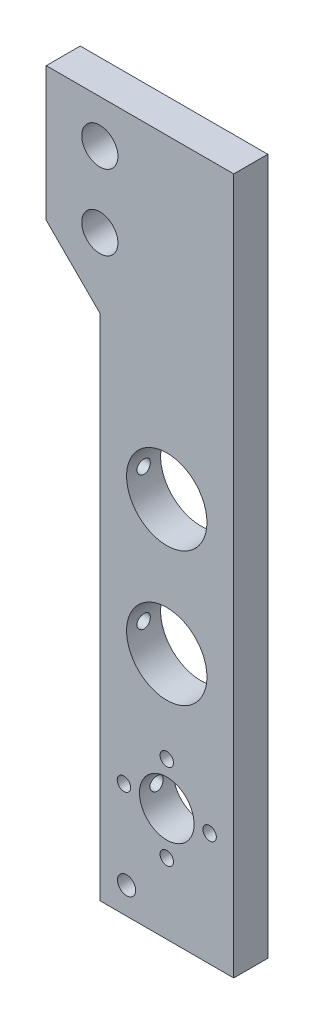
from build123d import *

# Parameters (mm, degrees)
SKETCH2_W                       = 25
SKETCH2_H                       = 130
SKETCH2_R                       = 5.1
SKETCH2_R_2                     = 7.5
BOSS_EXTRUDE1_DEPTH             = 6.35
TAP_DRILL_FOR_M3X0_5_TAP1_D     = 2.5
TAP_DRILL_FOR_M3X0_5_TAP1_DEPTH = 12.5
TAP_DRILL_FOR_M3X0_5_TAP1_TIP   = 0.751075774
BOSS_EXTRUDE2_DEPTH             = 6.35
F_1_4_CLEARANCE_HOLE1_D         = 6.7564
TAP_DRILL_FOR_M3X0_5_TAP2_D     = 2.5
M3_CLEARANCE_HOLE1_OUTLINE_R    = 1.7
M3_CLEARANCE_HOLE1_DEPTH        = 6.35


# Read off the part's stored shape, not the designer's step: M3 Clearance Hole1
with BuildPart() as part:
    # Sketch2 → Boss-Extrude1 (new body)
    with BuildSketch(Plane.XY):
        with Locations((0, 43.85)):
            Rectangle(SKETCH2_W, SKETCH2_H)
        Circle(SKETCH2_R, mode=Mode.SUBTRACT)
        with Locations((0, 25)):
            Circle(SKETCH2_R_2, mode=Mode.SUBTRACT)
        with Locations((0, 50)):
            Circle(SKETCH2_R_2, mode=Mode.SUBTRACT)
    extrude(amount=BOSS_EXTRUDE1_DEPTH)

    # Tap Drill for M3x0.5 Tap1
    with Locations(Plane.ZY.offset(12.5)):
        with Locations((3.175, 50), (3.175, 0), (3.175, 25)):
            Hole(TAP_DRILL_FOR_M3X0_5_TAP1_D / 2, depth=TAP_DRILL_FOR_M3X0_5_TAP1_DEPTH)
            with Locations((0, 0, -(TAP_DRILL_FOR_M3X0_5_TAP1_DEPTH + TAP_DRILL_FOR_M3X0_5_TAP1_TIP / 2))):  # 118° drill point
                Cone(0, TAP_DRILL_FOR_M3X0_5_TAP1_D / 2, TAP_DRILL_FOR_M3X0_5_TAP1_TIP, mode=Mode.SUBTRACT)

    # Sketch8 → Boss-Extrude2 (add)
    with BuildSketch(Plane(origin=(0, 0, 0), x_dir=(-1, 0, 0), z_dir=(0, 0, -1))):
        Polygon((12.5, 73.85), (22.5, 83.85), (22.5, 108.85), (12.5, 108.85), align=None)
    extrude(amount=-BOSS_EXTRUDE2_DEPTH)

    # 1/4 Clearance Hole1 (through all)
    with Locations(Plane.XY.offset(6.35)):
        with Locations((-12.5, 86.85), (-12.5, 100.85)):
            Hole(F_1_4_CLEARANCE_HOLE1_D / 2)

    # Tap Drill for M3x0.5 Tap2 (through all)
    with Locations(Plane.XY.offset(6.35)):
        with Locations((-8, 0), (0, 8), (8, 0), (0, -8)):
            Hole(TAP_DRILL_FOR_M3X0_5_TAP2_D / 2)

    # M3 Clearance Hole1 outline → M3 Clearance Hole1 (cut)
    with BuildSketch(Plane.XY):
        with Locations((-7.5, -16.15)):
            Circle(M3_CLEARANCE_HOLE1_OUTLINE_R)
    extrude(amount=M3_CLEARANCE_HOLE1_DEPTH, mode=Mode.SUBTRACT)


solid = part.part
